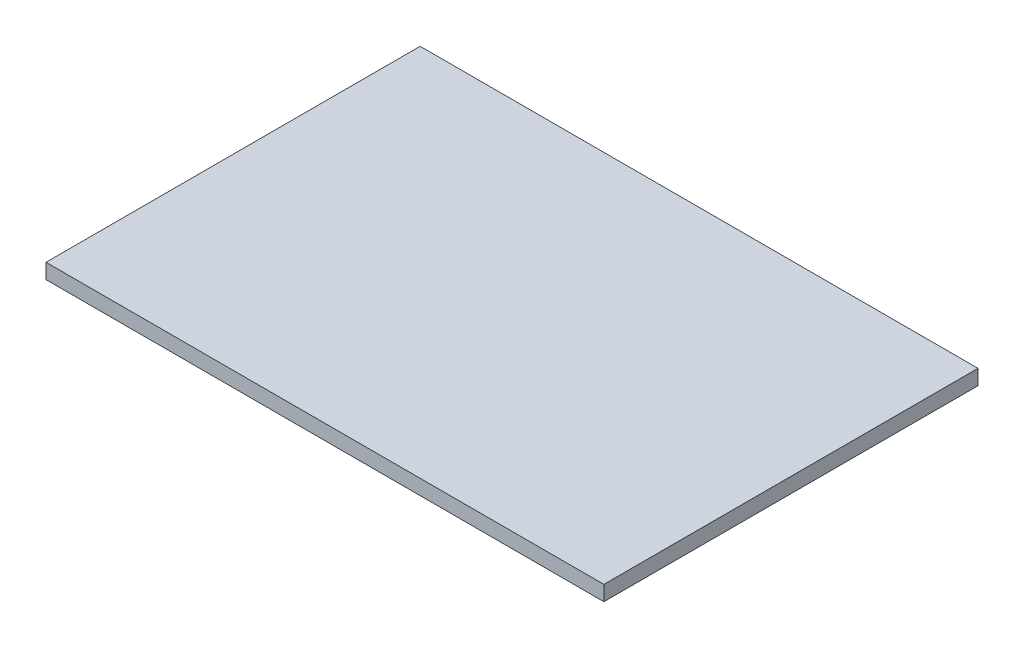
from build123d import *

# Parameters (mm, degrees)
SKETCH1_W           = 334
SKETCH1_H           = 224
BOSS_EXTRUDE1_DEPTH = 9


with BuildPart() as part:
    # Sketch1 → Boss-Extrude1 (new body)
    with BuildSketch(Plane(origin=(0, 0, 0), x_dir=(1, 0, 0), z_dir=(0, 1, 0))):
        Rectangle(SKETCH1_W, SKETCH1_H)
    extrude(amount=BOSS_EXTRUDE1_DEPTH)


solid = part.part
